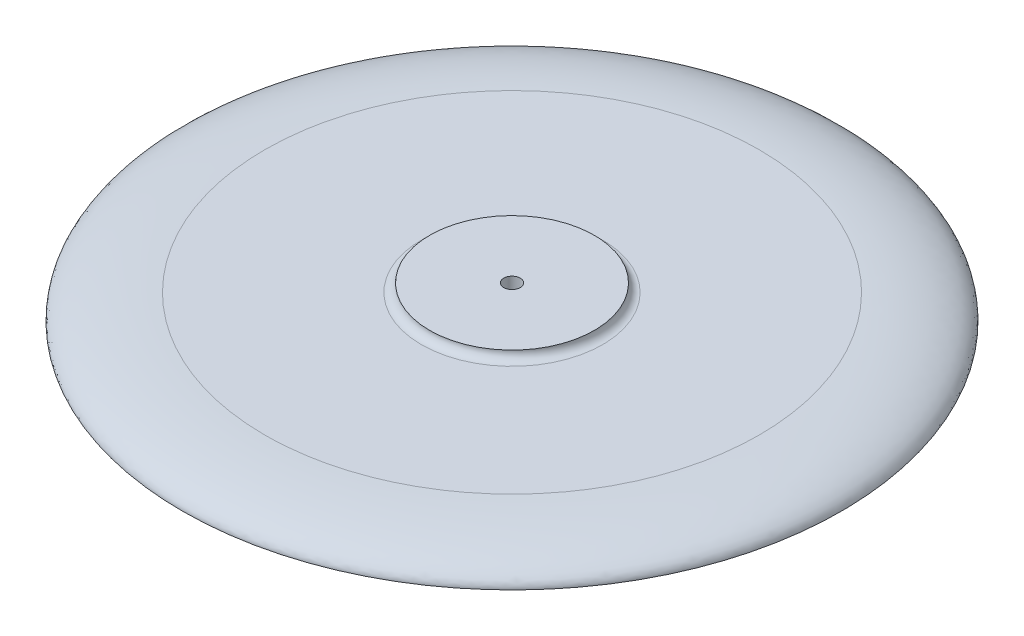
from build123d import *

# Parameters (mm, degrees)
SKETCH1_R           = 40
BOSS_EXTRUDE1_DEPTH = 3
SKETCH2_R           = 10
BOSS_EXTRUDE2_DEPTH = 1
SKETCH3_R           = 1
CUT_EXTRUDE1_DEPTH  = 57.709787515
FILLET1_R           = 1
FILLET2_SIZE        = 10
FILLET2_SIZE_2      = 3


# Some blends are built 0.0001 mm under size
with BuildPart() as part:
    # Sketch1 → Boss-Extrude1 (new body)
    with BuildSketch(Plane(origin=(0, 0, 0), x_dir=(1, 0, 0), z_dir=(0, 1, 0))):
        with Locations(Location((0, 0, 0), (0, 0, 270))):
            Circle(SKETCH1_R)
    extrude(amount=BOSS_EXTRUDE1_DEPTH)

    # Sketch2 → Boss-Extrude2 (add)
    with BuildSketch(Plane(origin=(0, 3, 0), x_dir=(1, 0, 0), z_dir=(0, 1, 0))):
        with Locations(Location((0, 0, 0), (0, 0, 270))):
            Circle(SKETCH2_R)
    extrude(amount=BOSS_EXTRUDE2_DEPTH)

    # Sketch3 → Cut-Extrude1 (cut, through all)
    with BuildSketch(Plane(origin=(0, 4, 0), x_dir=(1, 0, 0), z_dir=(0, 1, 0))):
        with Locations(Location((0, 0, 0), (0, 0, 270))):
            Circle(SKETCH3_R)
    extrude(amount=-CUT_EXTRUDE1_DEPTH, mode=Mode.SUBTRACT)

    # Fillet1
    fillet1_edges = [part.edges().sort_by_distance(p)[0] for p in [
        (0, 3, -10),
    ]]
    fillet(fillet1_edges, radius=FILLET1_R - 0.0001)  # a hair under: the kernel refuses the full size

    # Fillet2
    # an asymmetric fillet: 10, 3 mm, written as the material it takes off along each edge
    with BuildSketch(Plane(origin=(0, 3, 0), x_dir=(0, 0, 1), z_dir=(-1, 0, 0))) as fillet2_piece_1:
        with BuildLine():
            Bezier((40 - FILLET2_SIZE, 0), (40, 0), (40, -FILLET2_SIZE_2), weights=[1, 0.707106781, 1])
            Line((40, -FILLET2_SIZE_2), (40, 0))
            Line((40, 0), (40 - FILLET2_SIZE, 0))
        make_face()
    revolve(axis=Axis((0, 3, 0), (0, 1, 0)), mode=Mode.SUBTRACT)


solid = part.part
